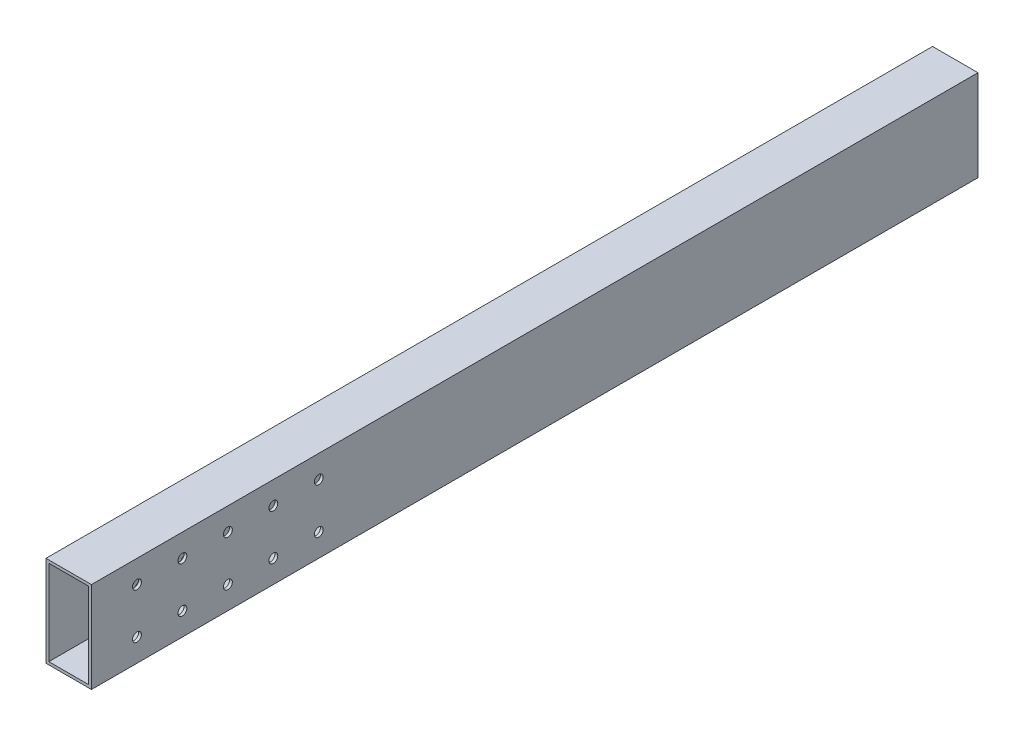
from build123d import *

# Parameters (mm, degrees)
SKETCH1_W           = 25.4
SKETCH1_H           = 50.8
SKETCH1_W_2         = 22.225
SKETCH1_H_2         = 47.625
BOSS_EXTRUDE1_DEPTH = 495.3
CUT_EXTRUDE1_REACH  = 500.546
SKETCH2_R           = 2.4892
CUT_EXTRUDE2_REACH  = 500.546
SKETCH3_R           = 14.2875
SKETCH3_R_2         = 2.4892
SKETCH2_3_R         = 2.4892
CUT_EXTRUDE5_DEPTH  = 499.54577523


with BuildPart() as part:
    # Sketch1 → Boss-Extrude1 (new body)
    with BuildSketch(Plane.XY):
        with Locations((12.7, 25.4)):
            Rectangle(SKETCH1_W, SKETCH1_H)
        with Locations((12.7, 25.4)):
            Rectangle(SKETCH1_W_2, SKETCH1_H_2, mode=Mode.SUBTRACT)
    extrude(amount=BOSS_EXTRUDE1_DEPTH)

    # Sketch2 → Cut-Extrude1 (cut, up to next)
    with BuildSketch(Plane.ZY.offset(-25.4), mode=Mode.PRIVATE) as cut_extrude1_sk1:
        with Locations((393.7, 38.1)):
            Circle(SKETCH2_R)
    cut_extrude1_tool1 = extrude(cut_extrude1_sk1.sketch, amount=CUT_EXTRUDE1_REACH, mode=Mode.PRIVATE) & part.part
    # Sketch2 → Cut-Extrude1 (cut, up to next)
    with BuildSketch(Plane.ZY.offset(-25.4), mode=Mode.PRIVATE) as cut_extrude1_sk2:
        with Locations((368.3, 38.1)):
            Circle(SKETCH2_R)
    cut_extrude1_tool2 = extrude(cut_extrude1_sk2.sketch, amount=CUT_EXTRUDE1_REACH, mode=Mode.PRIVATE) & part.part
    # Sketch2 → Cut-Extrude1 (cut, up to next)
    with BuildSketch(Plane.ZY.offset(-25.4), mode=Mode.PRIVATE) as cut_extrude1_sk3:
        with Locations((393.7, 12.7)):
            Circle(SKETCH2_R)
    cut_extrude1_tool3 = extrude(cut_extrude1_sk3.sketch, amount=CUT_EXTRUDE1_REACH, mode=Mode.PRIVATE) & part.part
    # Sketch2 → Cut-Extrude1 (cut, up to next)
    with BuildSketch(Plane.ZY.offset(-25.4), mode=Mode.PRIVATE) as cut_extrude1_sk4:
        with Locations((368.3, 12.7)):
            Circle(SKETCH2_R)
    cut_extrude1_tool4 = extrude(cut_extrude1_sk4.sketch, amount=CUT_EXTRUDE1_REACH, mode=Mode.PRIVATE) & part.part
    add(cut_extrude1_tool1.solids().sort_by_distance((25.4, 38.1, 393.7))[0], mode=Mode.SUBTRACT)
    add(cut_extrude1_tool2.solids().sort_by_distance((25.4, 38.1, 368.3))[0], mode=Mode.SUBTRACT)
    add(cut_extrude1_tool3.solids().sort_by_distance((25.4, 12.7, 393.7))[0], mode=Mode.SUBTRACT)
    add(cut_extrude1_tool4.solids().sort_by_distance((25.4, 12.7, 368.3))[0], mode=Mode.SUBTRACT)

    # Sketch3 → Cut-Extrude2 (cut, up to next)
    with BuildSketch(Plane.ZY, mode=Mode.PRIVATE) as cut_extrude2_sk1:
        with Locations((114.3, 25.4)):
            Circle(SKETCH3_R)
    cut_extrude2_tool1 = extrude(cut_extrude2_sk1.sketch, amount=-CUT_EXTRUDE2_REACH, mode=Mode.PRIVATE) & part.part
    # Sketch3 → Cut-Extrude2 (cut, up to next)
    with BuildSketch(Plane.ZY, mode=Mode.PRIVATE) as cut_extrude2_sk2:
        with Locations((139.7, 41.275)):
            Circle(SKETCH3_R_2)
    cut_extrude2_tool2 = extrude(cut_extrude2_sk2.sketch, amount=-CUT_EXTRUDE2_REACH, mode=Mode.PRIVATE) & part.part
    # Sketch3 → Cut-Extrude2 (cut, up to next)
    with BuildSketch(Plane.ZY, mode=Mode.PRIVATE) as cut_extrude2_sk3:
        with Locations((88.9, 41.275)):
            Circle(SKETCH3_R_2)
    cut_extrude2_tool3 = extrude(cut_extrude2_sk3.sketch, amount=-CUT_EXTRUDE2_REACH, mode=Mode.PRIVATE) & part.part
    # Sketch3 → Cut-Extrude2 (cut, up to next)
    with BuildSketch(Plane.ZY, mode=Mode.PRIVATE) as cut_extrude2_sk4:
        with Locations((88.9, 9.525)):
            Circle(SKETCH3_R_2)
    cut_extrude2_tool4 = extrude(cut_extrude2_sk4.sketch, amount=-CUT_EXTRUDE2_REACH, mode=Mode.PRIVATE) & part.part
    # Sketch3 → Cut-Extrude2 (cut, up to next)
    with BuildSketch(Plane.ZY, mode=Mode.PRIVATE) as cut_extrude2_sk5:
        with Locations((139.7, 9.525)):
            Circle(SKETCH3_R_2)
    cut_extrude2_tool5 = extrude(cut_extrude2_sk5.sketch, amount=-CUT_EXTRUDE2_REACH, mode=Mode.PRIVATE) & part.part
    add(cut_extrude2_tool1.solids().sort_by_distance((0, 25.4, 114.3))[0], mode=Mode.SUBTRACT)
    add(cut_extrude2_tool2.solids().sort_by_distance((0, 41.275, 139.7))[0], mode=Mode.SUBTRACT)
    add(cut_extrude2_tool3.solids().sort_by_distance((0, 41.275, 88.9))[0], mode=Mode.SUBTRACT)
    add(cut_extrude2_tool4.solids().sort_by_distance((0, 9.525, 88.9))[0], mode=Mode.SUBTRACT)
    add(cut_extrude2_tool5.solids().sort_by_distance((0, 9.525, 139.7))[0], mode=Mode.SUBTRACT)

    # Sketch2<3> → Cut-Extrude5 (cut, through all)
    with BuildSketch(Plane.ZY.offset(-25.4)):
        with Locations((444.5, 38.1)):
            Circle(SKETCH2_3_R)
        with Locations((419.1, 38.1)):
            Circle(SKETCH2_3_R)
        with Locations((444.5, 12.7)):
            Circle(SKETCH2_3_R)
        with Locations((419.1, 12.7)):
            Circle(SKETCH2_3_R)
        with Locations((469.9, 12.7)):
            Circle(SKETCH2_3_R)
        with Locations((469.9, 38.1)):
            Circle(SKETCH2_3_R)
    extrude(amount=CUT_EXTRUDE5_DEPTH, mode=Mode.SUBTRACT)


solid = part.part
